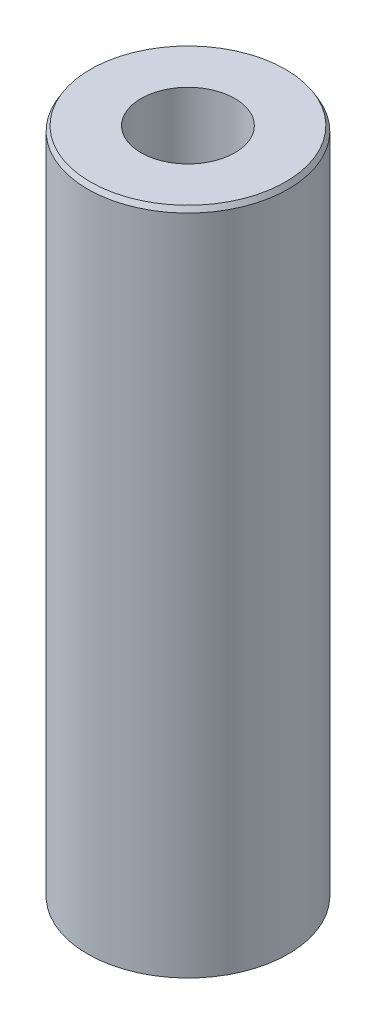
from build123d import *
from OCP.BRepFilletAPI import BRepFilletAPI_MakeChamfer

# Parameters (mm, degrees)
SKETCH1_R           = 37.5
BOSS_EXTRUDE1_DEPTH = 250.416213845
SKETCH2_R           = 17.562137287
CUT_EXTRUDE1_DEPTH  = 256.970272017
CHAMFER1_SIZE       = 1.801380254
CHAMFER1_SIZE2      = 1.040027375


with BuildPart() as part:
    # Sketch1 → Boss-Extrude1 (new body)
    with BuildSketch(Plane(origin=(0, 0, 0), x_dir=(1, 0, 0), z_dir=(0, 1, 0))):
        Circle(SKETCH1_R)
    extrude(amount=BOSS_EXTRUDE1_DEPTH)

    # Sketch2 → Cut-Extrude1 (cut, through all)
    with BuildSketch(Plane(origin=(0, 0, 0), x_dir=(1, 0, 0), z_dir=(0, 1, 0))):
        Circle(SKETCH2_R)
    extrude(amount=CUT_EXTRUDE1_DEPTH, mode=Mode.SUBTRACT)

    # Chamfer1: one chamfer whose edges measure the first distance from different faces: ONE call of the kernel's chamfer builder (chamfer() names one face for all edges)
    chamfer1_edges_1 = [part.edges().sort_by_distance(p)[0] for p in [
        (-37.5, 250.416213845, 0),
    ]]
    chamfer1_side_1 = [part.faces().sort_by_distance(p)[0] for p in [
        (-37.5, 125.208106922, 0),
    ]]
    chamfer1_edges_2 = [part.edges().sort_by_distance(p)[0] for p in [
        (-37.5, 0, 0),
    ]]
    chamfer1_side_2 = [part.faces().sort_by_distance(p)[0] for p in [
        (-36.439339828, 0, 0),
    ]]
    chamfer1 = BRepFilletAPI_MakeChamfer(part.part.solid().wrapped)
    for e in chamfer1_edges_1:
        chamfer1.Add(CHAMFER1_SIZE, CHAMFER1_SIZE2, e.wrapped, chamfer1_side_1[0].wrapped)  # the first distance lies on this face
    for e in chamfer1_edges_2:
        chamfer1.Add(CHAMFER1_SIZE, CHAMFER1_SIZE2, e.wrapped, chamfer1_side_2[0].wrapped)  # the first distance lies on this face
    add(Compound.cast(chamfer1.Shape()), mode=Mode.REPLACE)


solid = part.part
